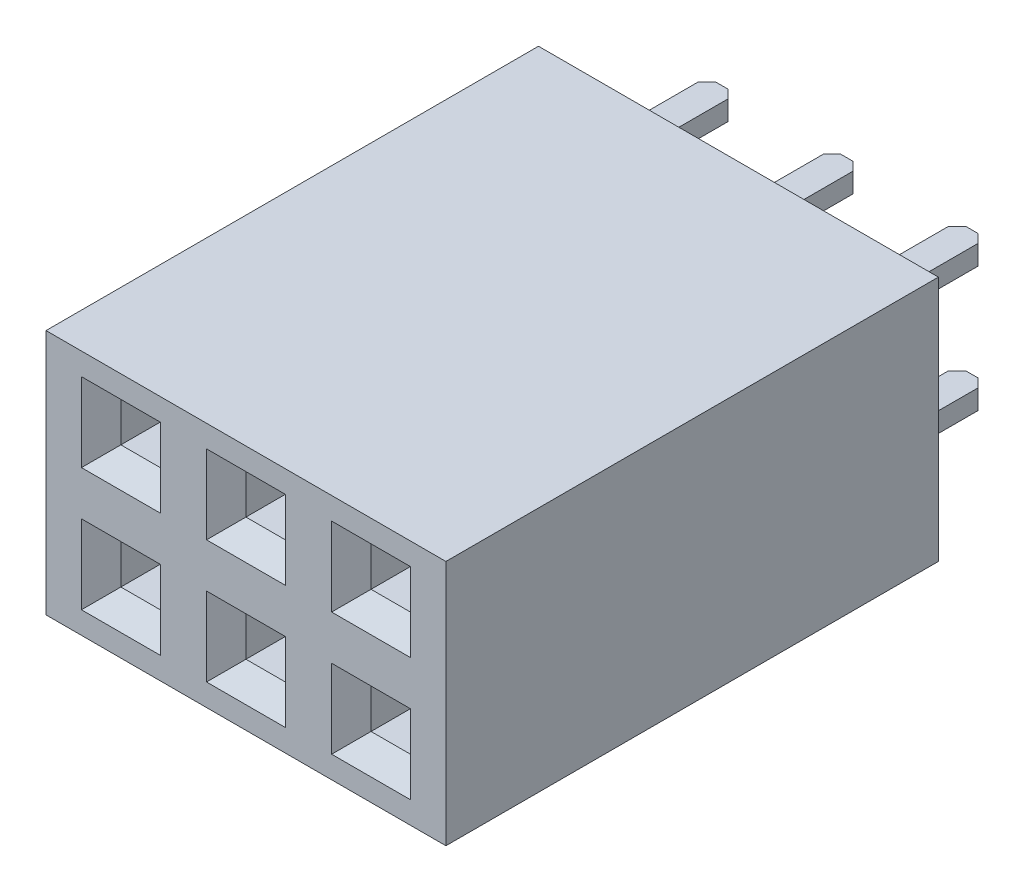
from build123d import *

# Parameters (mm, degrees)
SKETCH1_W            = 2.5
SKETCH1_H            = 10
BOSS_EXTRUDE1_DEPTH  = 1.52
SKETCH2_W            = 0.8
SKETCH2_H            = 0.8
CUT_EXTRUDE1_DEPTH   = 7
CHAMFER_1_SIZE       = 0.4
BOSS_EXTRUDE2_DEPTH  = 0.2
MIRROR_START         = -1.52
MIRROR_1_DEPTH       = 3.04
MIRROR_1_2_DEPTH     = 0.72
MIRROR_START_2       = 0.8
MIRROR_1_3_DEPTH     = 0.72
MIRROR_START_3       = -0.124264069
MIRROR_1_4_OUTLINE_W = 0.4
MIRROR_1_4_OUTLINE_H = 2.2
MIRROR_1_4_DEPTH     = 0.248528138
MIRROR_START_4       = 1
MIRROR_1_5_DEPTH     = 2.32
MIRROR_START_5       = 2.34
MIRROR_1_6_DEPTH     = 0.4
LPATTERN1_COUNT      = 3
LPATTERN1_PITCH      = 2.54


with BuildPart() as part:
    # Sketch1 → Boss-Extrude1 (new, symmetric)
    with BuildSketch(Plane(origin=(0, 0, 0), x_dir=(0, -1, 0), z_dir=(1, 0, 0))):
        with Locations((-0.02, -5)):
            Rectangle(SKETCH1_W, SKETCH1_H)
    extrude(amount=BOSS_EXTRUDE1_DEPTH, both=True)

    # Sketch2 → Cut-Extrude1 (cut)
    with BuildSketch(Plane(origin=(0, 0, 10), x_dir=(-1, 0, 0), z_dir=(0, 0, 1))):
        with Locations((0, -0.02)):
            Rectangle(SKETCH2_W, SKETCH2_H)
    extrude(amount=-CUT_EXTRUDE1_DEPTH, mode=Mode.SUBTRACT)

    # Фаска1
    chamfer_1_edges = [part.edges().sort_by_distance(p)[0] for p in [
        (-0.4, 0.02, 10),
        (0, -0.38, 10),
        (0.4, 0.02, 10),
        (0, 0.42, 10),
    ]]
    chamfer(chamfer_1_edges, length=CHAMFER_1_SIZE)

    # Sketch3 → Boss-Extrude2 (add, symmetric)
    with BuildSketch(Plane(origin=(0, 0, 0), x_dir=(1, 0, 0), z_dir=(0, 1, 0))):
        Polygon((-0.3, 0), (-0.3, 2.024264069), (-0.124264069, 2.2), (0.124264069, 2.2), (0.3, 2.024264069), (0.3, 0), align=None)
    extrude(amount=BOSS_EXTRUDE2_DEPTH, both=True)

    # Зеркальное отражение1: read off the stored shape, not the designer's step
    # Зеркальное отражение1 outline → Зеркальное отражение1 (add)
    with BuildSketch(Plane.YZ.offset(MIRROR_START)):
        Polygon((1.72, 10), (1.27, 10), (1.27, 0), (3.77, 0), (3.77, 10), (3.32, 10), (2.92, 9.6), (2.92, 3), (2.12, 3), (2.12, 9.6), align=None)
    extrude(amount=MIRROR_1_DEPTH)

    # Mirror 1 2 outline → Mirror 1 2 (add)
    with BuildSketch(Plane.YZ.offset(MIRROR_START)):
        Polygon((3.32, 10), (1.72, 10), (2.12, 9.6), (2.12, 3), (2.92, 3), (2.92, 9.6), align=None)
    extrude(amount=MIRROR_1_2_DEPTH)

    # Mirror 1 3 outline → Mirror 1 3 (add)
    with BuildSketch(Plane.YZ.offset(MIRROR_START_2)):
        Polygon((3.32, 10), (1.72, 10), (2.12, 9.6), (2.12, 3), (2.92, 3), (2.92, 9.6), align=None)
    extrude(amount=MIRROR_1_3_DEPTH)

    # Mirror 1 4 outline → Mirror 1 4 (add)
    with BuildSketch(Plane.YZ.offset(MIRROR_START_3)):
        with Locations((2.54, -1.1)):
            Rectangle(MIRROR_1_4_OUTLINE_W, MIRROR_1_4_OUTLINE_H)
    extrude(amount=MIRROR_1_4_DEPTH)

    # Mirror 1 5 outline → Mirror 1 5 (add)
    with BuildSketch(Plane(origin=(0, 0, 0), x_dir=(1, 0, 0), z_dir=(0, 1, 0)).offset(MIRROR_START_4)):
        Polygon((-0.8, -10), (-0.4, -9.6), (-0.4, -3), (-0.8, -3), align=None)
        Polygon((0.8, -3), (0.4, -3), (0.4, -9.6), (0.8, -10), align=None)
    extrude(amount=MIRROR_1_5_DEPTH)

    # Mirror 1 6 outline → Mirror 1 6 (add)
    with BuildSketch(Plane(origin=(0, 0, 0), x_dir=(1, 0, 0), z_dir=(0, 1, 0)).offset(MIRROR_START_5)):
        Polygon((0.124264069, 0), (0.3, 0), (0.3, 2.024264069), (0.124264069, 2.2), align=None)
        Polygon((-0.3, 0), (-0.124264069, 0), (-0.124264069, 2.2), (-0.3, 2.024264069), align=None)
    extrude(amount=MIRROR_1_6_DEPTH)


with BuildPart() as lpattern1_1:
    # LPattern1: pattern copy
    add(part.part.moved(Location(Vector(1, 0, 0) * (1 * LPATTERN1_PITCH))))


with BuildPart() as lpattern1_2:
    # LPattern1: pattern copy
    add(part.part.moved(Location(Vector(1, 0, 0) * (2 * LPATTERN1_PITCH))))

    # Combine 1: union LPattern1_1, part
    add(lpattern1_1.part)
    add(part.part)


solid = lpattern1_2.part
